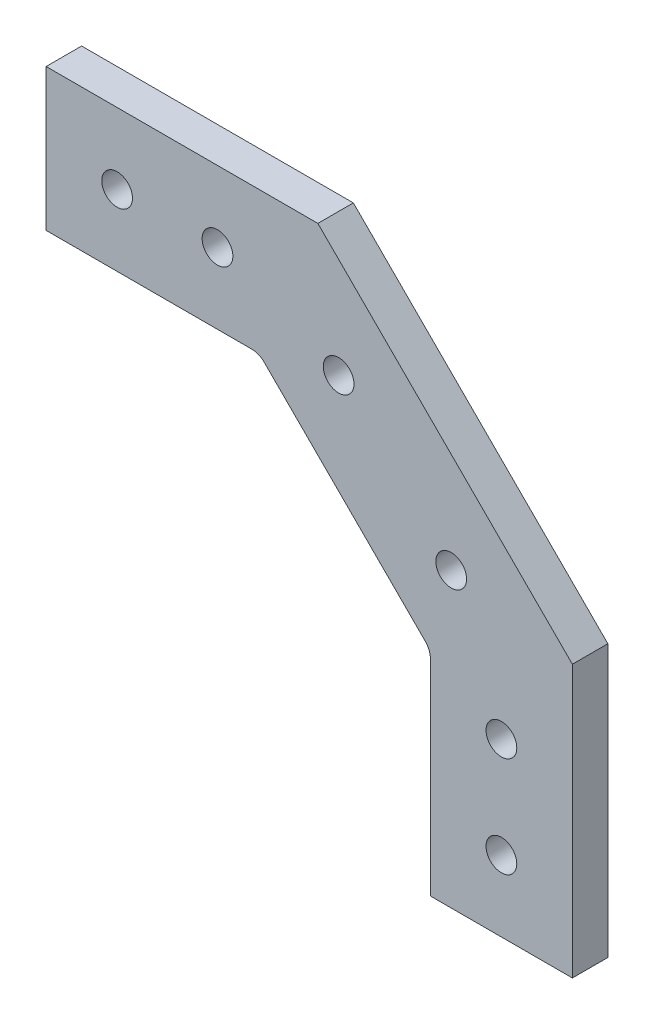
from build123d import *

# Parameters (mm, degrees)
BOSS_EXTRUDE1_DEPTH      = 6.35
FILLET1_R                = 3.175
M5_CLEARANCE_HOLE1_D     = 5.5
M5_CLEARANCE_HOLE1_DEPTH = 18.75
M5_CLEARANCE_HOLE1_TIP   = 1.652366702


with BuildPart() as part:
    # Sketch1 → Boss-Extrude1 (new body)
    with BuildSketch(Plane.XY):
        Polygon((0, 38.1), (0, 58.239487758), (-30.660512242, 88.9), (-68.760512242, 88.9), (-68.760512242, 114.3), (-20.139487758, 114.3), (25.4, 68.760512242), (25.4, 63.5), (25.4, 38.1), (25.4, 20.139487758), (0, 20.139487758), align=None)
    extrude(amount=BOSS_EXTRUDE1_DEPTH)

    # Fillet1
    fillet1_edges = [part.edges().sort_by_distance(p)[0] for p in [
        (-30.660512242, 88.9, 3.175),
        (0, 58.239487758, 3.175),
    ]]
    fillet(fillet1_edges, radius=FILLET1_R)

    # M5 Clearance Hole1
    with Locations(Plane.XY.offset(6.35)):
        with Locations((12.7, 50.8), (3.719743879, 72.480256121), (-16.419743879, 92.619743879), (-38.1, 101.6), (-56.060512242, 101.6), (12.7, 32.839487758)):
            Hole(M5_CLEARANCE_HOLE1_D / 2, depth=M5_CLEARANCE_HOLE1_DEPTH)
            with Locations((0, 0, -(M5_CLEARANCE_HOLE1_DEPTH + M5_CLEARANCE_HOLE1_TIP / 2))):  # 118° drill point
                Cone(0, M5_CLEARANCE_HOLE1_D / 2, M5_CLEARANCE_HOLE1_TIP, mode=Mode.SUBTRACT)


solid = part.part
